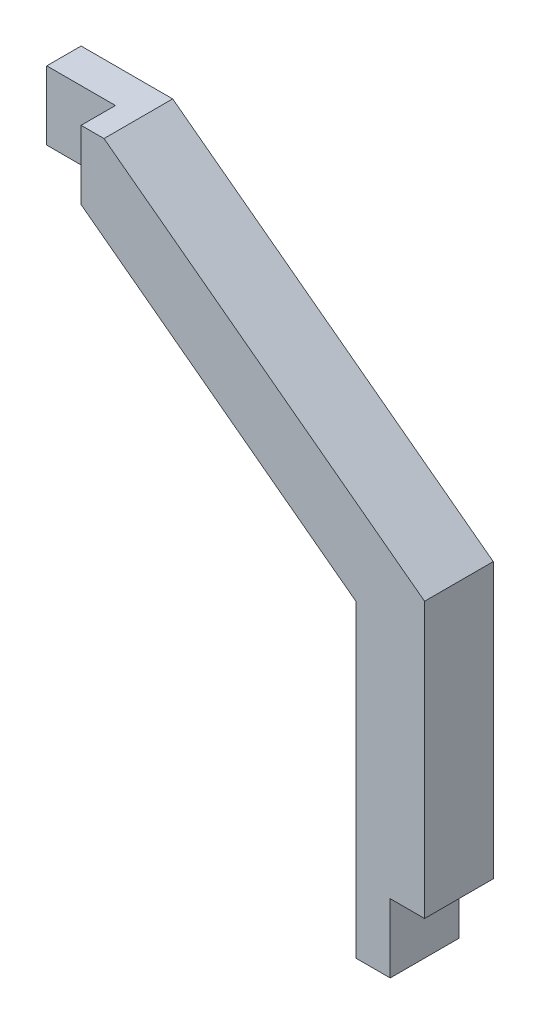
from build123d import *

# Parameters (mm, degrees)
SALIENTE_EXTRUIR1_DEPTH = 20
CROQUIS2_W              = 20
CROQUIS2_H              = 20
CORTAR_EXTRUIR1_DEPTH   = 10
CROQUIS3_W              = 20
CROQUIS3_H              = 20
CORTAR_EXTRUIR2_DEPTH   = 10


with BuildPart() as part:
    # Croquis1 → Saliente-Extruir1 (new body)
    with BuildSketch(Plane.XY):
        Polygon((-60, 0), (-33.333333333, 0), (60, -70), (60, -170), (40, -170), (40, -80), (-40, -20), (-60, -20), align=None)
    extrude(amount=SALIENTE_EXTRUIR1_DEPTH)

    # Croquis2 → Cortar-Extruir1 (cut)
    with BuildSketch(Plane.XY.offset(20)):
        with Locations((-50, -10)):
            Rectangle(CROQUIS2_W, CROQUIS2_H)
    extrude(amount=-CORTAR_EXTRUIR1_DEPTH, mode=Mode.SUBTRACT)

    # Croquis3 → Cortar-Extruir2 (cut)
    with BuildSketch(Plane(origin=(60, 0, 0), x_dir=(0, 0, -1), z_dir=(1, 0, 0))):
        with Locations((-10, -160)):
            Rectangle(CROQUIS3_W, CROQUIS3_H)
    extrude(amount=-CORTAR_EXTRUIR2_DEPTH, mode=Mode.SUBTRACT)


solid = part.part
